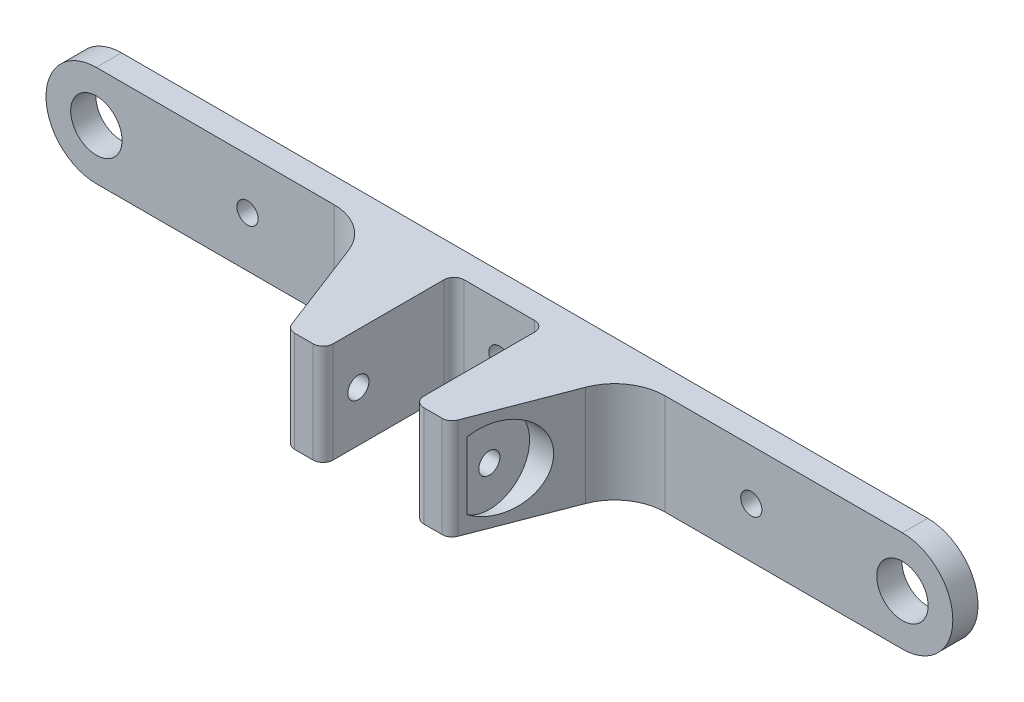
from build123d import *
from OCP.BRepFilletAPI import BRepFilletAPI_MakeChamfer

# Parameters (mm, degrees)
BOSS_EXTRU_1_DEPTH           = 5
ESQUISSE2_R                  = 5.1
ESQUISSE2_R_2                = 2.1
ENL_V_MAT_EXTRU_1_DEPTH      = 91.691785736
ESQUISSE3_W                  = 32
ESQUISSE3_H                  = 20
BOSS_EXTRU_2_DEPTH           = 26
CHANFREIN1_SIZE              = 10
CHANFREIN1_SIZE_2            = 26
CONG_1_R                     = 10
ESQUISSE4_W                  = 18
ESQUISSE4_H                  = 20
ENL_V_MAT_EXTRU_2_DEPTH      = 26
CONG_2_R                     = 2
ENL_V_MAT_EXTRU_3_DEPTH      = 105.220919205
ENL_V_MAT_EXTRU_3_DEPTH_BACK = 105.220919205
ESQUISSE5_R                  = 2.1
ENL_V_START                  = -8
ESQUISSE6_R                  = 8
ENL_V_MAT_EXTRU_4_DEPTH      = 26
ESQUISSE7_R                  = 8
ENL_V_MAT_EXTRU_5_DEPTH      = 97.220919205
CONG_3_START                 = -11
CONG_3_DEPTH                 = 22
SKETCH1_R                    = 2.1
CUT_EXTRUDE1_DEPTH           = 95.212525707


with BuildPart() as part:
    # Esquisse1 → Boss.-Extru.1 (new body)
    with BuildSketch(Plane.XY):
        with BuildLine():
            Line((-80, 10), (80, 10))
            ThreePointArc((80, 10), (90, 0), (80, -10))
            Line((80, -10), (-80, -10))
            ThreePointArc((-80, -10), (-90, 0), (-80, 10))
        make_face()
    extrude(amount=BOSS_EXTRU_1_DEPTH)

    # Esquisse2 → Enlèv. mat.-Extru.1 (cut, through all)
    with BuildSketch(Plane.XY.offset(5)):
        with Locations((-80, 0)):
            Circle(ESQUISSE2_R)
        with Locations((80, 0)):
            Circle(ESQUISSE2_R)
        with Locations((-50, 0)):
            Circle(ESQUISSE2_R_2)
        with Locations((50, 0)):
            Circle(ESQUISSE2_R_2)
    extrude(amount=-ENL_V_MAT_EXTRU_1_DEPTH, mode=Mode.SUBTRACT)

    # Esquisse3 → Boss.-Extru.2 (add)
    with BuildSketch(Plane.XY.offset(5)):
        Rectangle(ESQUISSE3_W, ESQUISSE3_H)
    extrude(amount=BOSS_EXTRU_2_DEPTH)

    # Chanfrein1
    chanfrein1_edges_1 = [part.edges().sort_by_distance(p)[0] for p in [
        (16, 0, 5),
    ]]
    chanfrein1_side_1 = [part.faces().sort_by_distance(p)[0] for p in [
        (16.2, 0, 5),
    ]]
    chanfrein1_edges_2 = [part.edges().sort_by_distance(p)[0] for p in [
        (-16, 0, 5),
    ]]
    chanfrein1_side_2 = [part.faces().sort_by_distance(p)[0] for p in [
        (-16.2, 0, 5),
    ]]
    chanfrein1 = BRepFilletAPI_MakeChamfer(part.part.solid().wrapped)
    for e in chanfrein1_edges_1:
        chanfrein1.Add(CHANFREIN1_SIZE - 0.0001, CHANFREIN1_SIZE_2 - 0.0001, e.wrapped, chanfrein1_side_1[0].wrapped)
    for e in chanfrein1_edges_2:
        chanfrein1.Add(CHANFREIN1_SIZE - 0.0001, CHANFREIN1_SIZE_2 - 0.0001, e.wrapped, chanfrein1_side_2[0].wrapped)
    add(Compound.cast(chanfrein1.Shape()), mode=Mode.REPLACE)  # a hair under: the kernel refuses the full size

    # Congé1
    cong_1_edges = [part.edges().sort_by_distance(p)[0] for p in [
        (25.9999, 0, 5),
        (-25.9999, 0, 5),
    ]]
    fillet(cong_1_edges, radius=CONG_1_R)

    # Esquisse4 → Enlèv. mat.-Extru.2 (cut)
    with BuildSketch(Plane.XY.offset(31)):
        Rectangle(ESQUISSE4_W, ESQUISSE4_H)
    extrude(amount=-ENL_V_MAT_EXTRU_2_DEPTH, mode=Mode.SUBTRACT)

    # Congé2
    cong_2_edges = [part.edges().sort_by_distance(p)[0] for p in [
        (9, 0, 5),
        (-9, 0, 5),
    ]]
    fillet(cong_2_edges, radius=CONG_2_R)

    # Esquisse5 → Enlèv. mat.-Extru.3 (cut, two sides: drawn at the far end of the back side and taken through both)
    with BuildSketch(Plane.ZY.offset(-9).offset(-ENL_V_MAT_EXTRU_3_DEPTH_BACK)):
        with Locations((24, 0)):
            Circle(ESQUISSE5_R)
    extrude(amount=ENL_V_MAT_EXTRU_3_DEPTH + ENL_V_MAT_EXTRU_3_DEPTH_BACK, mode=Mode.SUBTRACT)

    # Esquisse6 → Enlèv. mat.-Extru.4 (cut)
    with BuildSketch(Plane.ZY.offset(-9).offset(ENL_V_START)):
        with Locations((24, 0)):
            Circle(ESQUISSE6_R)
    extrude(amount=-ENL_V_MAT_EXTRU_4_DEPTH, mode=Mode.SUBTRACT)

    # Esquisse7 → Enlèv. mat.-Extru.5 (cut, through all)
    with BuildSketch(Plane(origin=(-9, 0, 0), x_dir=(0, 0, -1), z_dir=(1, 0, 0)).offset(ENL_V_START)):
        with Locations((-24, 0)):
            Circle(ESQUISSE7_R)
    extrude(amount=-ENL_V_MAT_EXTRU_5_DEPTH, mode=Mode.SUBTRACT)

    # Congé3: read off the stored shape, not the designer's step
    # Congé3 outline → Congé3 (cut)
    with BuildSketch(Plane(origin=(0, 0, 0), x_dir=(1, 0, 0), z_dir=(0, 1, 0)).offset(CONG_3_START)):
        with BuildLine():
            Line((-9, -31), (-9, -29))
            ThreePointArc((-9, -29), (-9.585786438, -30.414213562), (-11, -31))
            Line((-11, -31), (-9, -31))
        make_face()
        with BuildLine():
            Line((-16, -31), (-14.626401804, -31))
            ThreePointArc((-14.626401804, -31), (-15.758674669, -30.64862311), (-16.493093016, -29.717958159))
            Line((-16.493093016, -29.717958159), (-16, -31))
        make_face()
        with BuildLine():
            ThreePointArc((16.493093016, -29.717958159), (15.758674669, -30.64862311), (14.626401804, -31))
            Line((14.626401804, -31), (16, -31))
            Line((16, -31), (16.493093016, -29.717958159))
        make_face()
        with BuildLine():
            ThreePointArc((11, -31), (9.585786438, -30.414213562), (9, -29))
            Line((9, -29), (9, -31))
            Line((9, -31), (11, -31))
        make_face()
    extrude(amount=CONG_3_DEPTH, mode=Mode.SUBTRACT)

    # Sketch1 → Cut-Extrude1 (cut, through all)
    with BuildSketch(Plane.XY.offset(5)):
        Circle(SKETCH1_R)
    extrude(amount=-CUT_EXTRUDE1_DEPTH, mode=Mode.SUBTRACT)


solid = part.part
